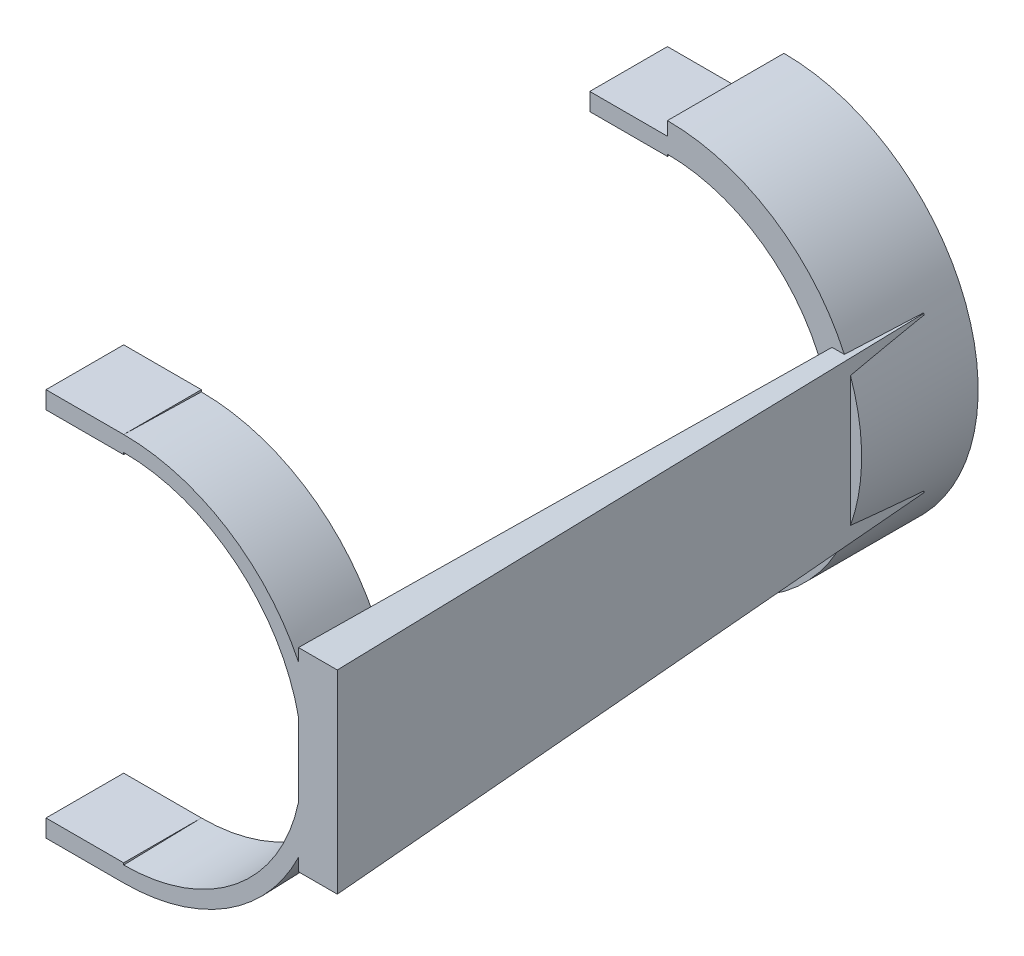
from build123d import *

# Parameters (mm, degrees)
REVOLVE_1_ANGLE     = 180
SKETCH_2_W          = 120
SKETCH_2_H          = 124.466444362
CUT_EXTRUDE_1_DEPTH = 175.928556845
SKETCH_6_W          = 20
SKETCH_6_H          = 4.5
EXTRUDE_1_DEPTH     = 20
EXTRUDE_3_DEPTH     = 30


with BuildPart() as part:
    # 草图1 → 旋转1 (revolve)
    with BuildSketch(Plane(origin=(0, 0, 0), x_dir=(0, 0, -1), z_dir=(1, 0, 0))):
        Polygon((160, 46), (0, 50), (0, 46), (160, 42), align=None)
    revolve(axis=Axis((0, 0, 0), (0, 0, -1)), revolution_arc=REVOLVE_1_ANGLE)

    # 草图2 → 切除-拉伸1 (cut, through all)
    with BuildSketch(Plane(origin=(0, 0, 0), x_dir=(0, 0, -1), z_dir=(1, 0, 0))):
        with Locations((80, -2.118201403)):
            Rectangle(SKETCH_2_W, SKETCH_2_H)
    extrude(amount=CUT_EXTRUDE_1_DEPTH, mode=Mode.SUBTRACT)


with BuildPart() as cut_extrude_1_piece_1:
    # of the separate pieces the step leaves, piece 1, a body of its own (cut_extrude_1_pieces)
    add(part.part.solids().sort_by_distance((0, 49.5, -20))[0])



with BuildPart() as cut_extrude_1_piece_2:
    # of the separate pieces the step leaves, piece 2, a body of its own (cut_extrude_1_pieces)
    add(part.part.solids().sort_by_distance((0, 46, -160))[0])


with BuildPart() as cut_extrude_1_piece_1_1:
    add(cut_extrude_1_piece_1.part)

    add(cut_extrude_1_piece_2.part)  # 放样1 merges 切除-拉伸1 piece 2
    # 草图3 → 放样1 section 0
    with BuildSketch(Plane.XY):
        with BuildLine():
            Line((55, 25), (45, 25))
            Line((45, 25), (45, -25))
            Line((45, -25), (55, -25))
            Line((55, -25), (55, 25))
        make_face()
    # 草图4 → 放样1 section 1
    with BuildSketch(Plane(origin=(0, 0, -160), x_dir=(-1, 0, 0), z_dir=(0, 0, -1))):
        with BuildLine():
            Line((-46, 20), (-42, 20))
            Line((-42, 20), (-42, -20))
            Line((-42, -20), (-46, -20))
            Line((-46, -20), (-46, 20))
        make_face()
    loft()

    # 草图6 → 凸台-拉伸1 (add)
    with BuildSketch(Plane.ZY):
        with Locations((-10, 47.75)):
            Rectangle(SKETCH_6_W, SKETCH_6_H)
        with Locations((-10, -47.75)):
            Rectangle(SKETCH_6_W, SKETCH_6_H)
        with Locations((-150, -44.25)):
            Rectangle(SKETCH_6_W, SKETCH_6_H)
        with Locations((-150, 44.25)):
            Rectangle(SKETCH_6_W, SKETCH_6_H)
    extrude(amount=EXTRUDE_1_DEPTH)

    # 草图8 → 凸台-拉伸3 (add)
    with BuildSketch(Plane.XY.offset(-140)):
        with BuildLine():
            Line((0, 46), (0, 50))
            ThreePointArc((0, 50), (50, 0), (0, -50))
            Line((0, -50), (0, -46))
            ThreePointArc((0, -46), (46, 0), (0, 46))
        make_face()
    extrude(amount=-EXTRUDE_3_DEPTH)


solid = cut_extrude_1_piece_1_1.part
